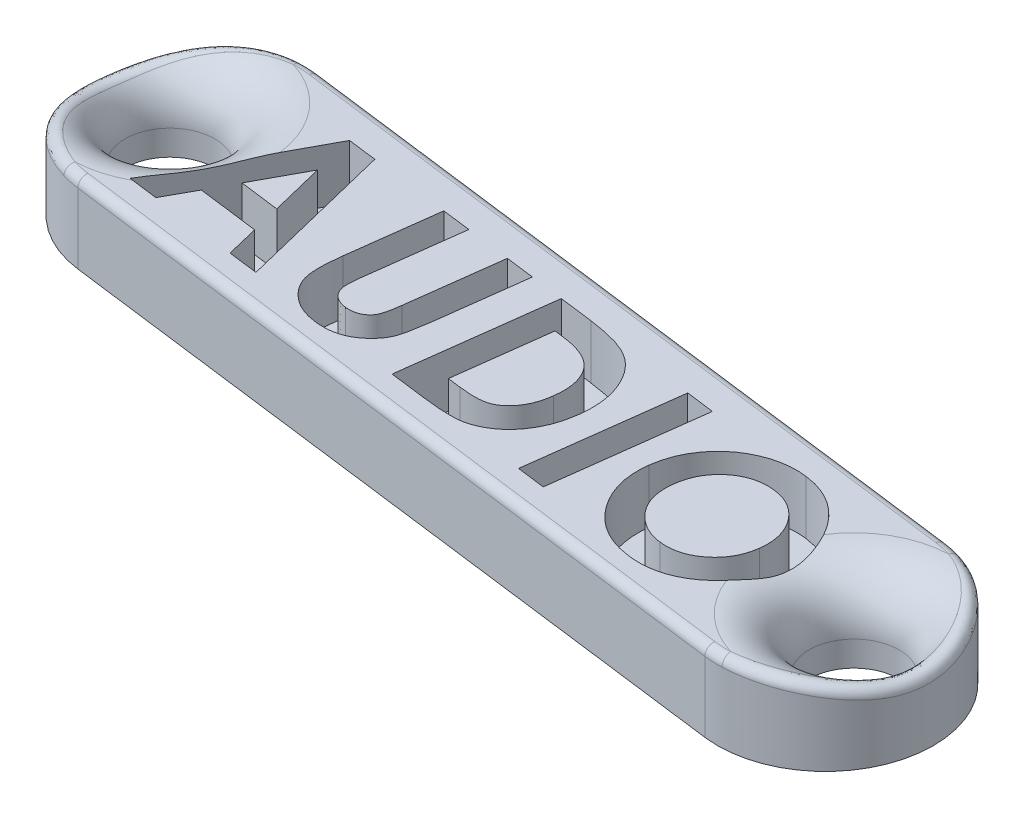
from build123d import *

# Parameters (mm, degrees)
BOSS_EXTRUDE1_DEPTH = 2.2
SKETCH3_R           = 1.25
CUT_EXTRUDE1_DEPTH  = 3
CUT_EXTRUDE2_DEPTH  = 1.5
FILLET1_R           = 1.5
FILLET7_R           = 0.25


with BuildPart() as part:
    # Sketch1 → Boss-Extrude1 (new body)
    with BuildSketch(Plane(origin=(0, 0, 0), x_dir=(1, 0, 0), z_dir=(0, 1, 0))):
        with BuildLine():
            Line((-9.619052023, 4.255904619), (10.380947977, 1.695525004))
            ThreePointArc((10.380947977, 1.695525004), (12.975714811, -1.661137785), (9.619052023, -4.255904619))
            Line((9.619052023, -4.255904619), (-10.380947977, -1.695525004))
            ThreePointArc((-10.380947977, -1.695525004), (-12.975714811, 1.661137785), (-9.619052023, 4.255904619))
        make_face()
    extrude(amount=BOSS_EXTRUDE1_DEPTH)

    # Sketch3 → Cut-Extrude1 (cut)
    with BuildSketch(Plane(origin=(0, 2.2, 0), x_dir=(1, 0, 0), z_dir=(0, 1, 0))):
        with Locations(Location((-10.910954308, 1.39680925, 0), (0, 0, 270))):
            Circle(SKETCH3_R)
        with Locations(Location((10.910954308, -1.39680925, 0), (0, 0, 270))):
            Circle(SKETCH3_R)
    extrude(amount=-CUT_EXTRUDE1_DEPTH, mode=Mode.SUBTRACT)

    # Sketch2 → Cut-Extrude2 (cut)
    # profile 1 of 5: a face of its own
    with BuildSketch(Plane(origin=(0, 2.2, 0), x_dir=(1, 0, 0), z_dir=(0, 1, 0))):
        Polygon((-7.499907306, 2.981760172), (-6.695133001, 2.879149328), (-5.624079315, -1.498348001), (-6.449206185, -1.392345063), (-6.665452178, -0.491744101), (-8.366587328, -0.273802061), (-8.816887809, -1.089600672), (-9.642014678, -0.983597734), align=None)
        Polygon((-7.233627926, 1.824208089), (-7.972256398, 0.462282341), (-6.863889678, 0.320662416), align=None, mode=Mode.SUBTRACT)
    # profile 2 of 5: a face of its own
    with BuildSketch(Plane(origin=(0, 2.2, 0), x_dir=(1, 0, 0), z_dir=(0, 1, 0))):
        with BuildLine():
            Line((-4.492346767, 2.596629268), (-3.695204673, 2.494866447))
            Line((-3.695204673, 2.494866447), (-4.041198263, -0.20524039))
            add(Edge.make_bspline(
                [(-4.041198263, -0.20524039), (-4.044350543, -0.233220092), (-4.050428196, -0.28716546), (-4.058510565, -0.365109825), (-4.062947319, -0.436976614), (-4.063410598, -0.502899724), (-4.062904462, -0.562579528), (-4.059993215, -0.616179761), (-4.053019993, -0.663481555), (-4.040986997, -0.717940974), (-4.018879198, -0.780298887), (-3.979474082, -0.847394566), (-3.932171943, -0.910674282), (-3.871915712, -0.965548078), (-3.802711013, -1.01297883), (-3.724150919, -1.05080237), (-3.636902593, -1.077913456), (-3.575229403, -1.087945078), (-3.543408466, -1.093120999)],
                knots=[0, 0, 0, 0, 1.150530379, 2.218243335, 3.20172775, 4.091186529, 4.911349013, 5.640491897, 6.282451106, 6.862508571, 7.918410735, 8.968548265, 10.031251396, 11.134605503, 12.281535566, 13.449044401, 14.683807366, 16, 16, 16, 16], degree=3))
            add(Edge.make_bspline(
                [(-3.543408466, -1.093120999), (-3.50951621, -1.096299337), (-3.443437117, -1.102496083), (-3.346371442, -1.096269477), (-3.254677658, -1.077967009), (-3.170325373, -1.04510445), (-3.09324207, -1.003719818), (-3.027059304, -0.951794881), (-2.970948657, -0.892827295), (-2.932839635, -0.835671257), (-2.908529546, -0.782208761), (-2.889619828, -0.734030362), (-2.873292382, -0.676446056), (-2.856334934, -0.610910285), (-2.840221539, -0.536510236), (-2.825097352, -0.453343143), (-2.810841722, -0.361420578), (-2.802385443, -0.297128107), (-2.797995806, -0.263754012)],
                knots=[0, 0, 0, 0, 1.264246848, 2.464878296, 3.602902448, 4.727446823, 5.818930376, 6.845081526, 7.841566789, 8.835776144, 9.38129008, 10.023558647, 10.758576168, 11.6050415, 12.541145857, 13.588560298, 14.748226399, 16, 16, 16, 16], degree=3))
            Line((-2.797995806, -0.263754012), (-2.464722569, 2.337134075))
            Line((-2.464722569, 2.337134075), (-1.667580475, 2.235371255))
            Line((-1.667580475, 2.235371255), (-1.986437312, -0.251881683))
            add(Edge.make_bspline(
                [(-1.986437312, -0.251881683), (-1.993054605, -0.302220216), (-2.005783853, -0.39905313), (-2.026749363, -0.537917819), (-2.049201186, -0.664452884), (-2.070366291, -0.778984655), (-2.094381833, -0.880637717), (-2.118168058, -0.969979039), (-2.141131231, -1.047713975), (-2.175273393, -1.1347151), (-2.225558103, -1.234314336), (-2.302115313, -1.345418171), (-2.39348753, -1.452943766), (-2.499119968, -1.553796451), (-2.614695491, -1.645808464), (-2.738404595, -1.723469558), (-2.8679181, -1.786100148), (-3.004144343, -1.832024883), (-3.147512338, -1.862987723), (-3.299075182, -1.87729693), (-3.459596271, -1.879018977), (-3.568637728, -1.866851349), (-3.624818723, -1.860582271)],
                knots=[0, 0, 0, 0, 1.15283147, 2.217625841, 3.188433464, 4.070854866, 4.861764269, 5.559257831, 6.170365235, 6.700775839, 7.679613089, 8.69613027, 9.757126222, 10.878381655, 12.007107569, 13.105890525, 14.188183861, 15.265976203, 16.36248846, 17.510808412, 18.71750375, 20, 20, 20, 20], degree=3))
            add(Edge.make_bspline(
                [(-3.624818723, -1.860582271), (-3.661909307, -1.855010728), (-3.735024734, -1.844027733), (-3.842048143, -1.821513151), (-3.944186068, -1.791477138), (-4.041934896, -1.755849134), (-4.135734535, -1.714444754), (-4.224372852, -1.66587675), (-4.309245564, -1.612378123), (-4.38831571, -1.552389354), (-4.46153699, -1.487874984), (-4.530055548, -1.4216295), (-4.592115734, -1.352585716), (-4.645966787, -1.279571148), (-4.696040464, -1.206385125), (-4.737642493, -1.129085099), (-4.772905651, -1.04956648), (-4.803995577, -0.96643463), (-4.826941415, -0.874897005), (-4.8436543, -0.772236031), (-4.853184724, -0.656569253), (-4.857158129, -0.52836875), (-4.855437888, -0.387166739), (-4.846373053, -0.233053127), (-4.832062674, -0.06591144), (-4.818330576, 0.049485311), (-4.811203605, 0.10937633)],
                knots=[0, 0, 0, 0, 1.021325217, 2.013304236, 2.975565624, 3.918039621, 4.845044506, 5.764765062, 6.668102515, 7.574942875, 8.464230678, 9.324352422, 10.169496251, 10.988574592, 11.793494596, 12.582351764, 13.374918752, 14.161519028, 14.996114242, 15.940221643, 16.991229592, 18.154278434, 19.432254303, 20.83542015, 22.357580195, 24, 24, 24, 24], degree=3))
            Line((-4.811203605, 0.10937633), (-4.492346767, 2.596629268))
        make_face()
    # profile 3 of 5: a face of its own
    with BuildSketch(Plane(origin=(0, 2.2, 0), x_dir=(1, 0, 0), z_dir=(0, 1, 0))):
        with BuildLine():
            Line((-0.746413076, 2.117703395), (0.194893014, 1.996436034))
            add(Edge.make_bspline(
                [(0.194893014, 1.996436034), (0.268207414, 1.986621769), (0.410171681, 1.967617657), (0.614456643, 1.929528599), (0.803827753, 1.889072628), (0.977246792, 1.841371525), (1.135365761, 1.789123158), (1.278137773, 1.731908867), (1.405313112, 1.669190445), (1.518385197, 1.600622546), (1.620030318, 1.52411208), (1.714994541, 1.441340375), (1.803664765, 1.349924326), (1.88612782, 1.250370924), (1.96227881, 1.142415072), (2.03299089, 1.026634777), (2.097384663, 0.902444845), (2.155515183, 0.770785272), (2.206527456, 0.633390455), (2.247221048, 0.490725264), (2.278698848, 0.344294674), (2.299737629, 0.193208995), (2.311455764, 0.038283015), (2.314069694, -0.121149214), (2.306483902, -0.284566909), (2.294088706, -0.394480364), (2.287815023, -0.450111775)],
                knots=[0, 0, 0, 0, 1.441511073, 2.791307885, 4.049291889, 5.214859528, 6.295106222, 7.293692796, 8.210315823, 9.056038773, 9.867075778, 10.687046818, 11.509180812, 12.346552832, 13.20418093, 14.082029974, 14.988914079, 15.928757192, 16.885756699, 17.843136786, 18.817878494, 19.802782428, 20.814011466, 21.844465783, 22.909001535, 24, 24, 24, 24], degree=3))
            add(Edge.make_bspline(
                [(2.287815023, -0.450111775), (2.275604058, -0.528674297), (2.251582925, -0.683220711), (2.192776358, -0.907195875), (2.114375971, -1.118671054), (2.018125937, -1.316694615), (1.90574764, -1.498749151), (1.779582139, -1.662738742), (1.641023209, -1.808410328), (1.48914204, -1.932326087), (1.330050054, -2.036597389), (1.16642745, -2.120719996), (0.999082539, -2.182928563), (0.854627569, -2.218828077), (0.730255832, -2.233943263), (0.622717517, -2.241776252), (0.500451416, -2.242381886), (0.363540207, -2.240406049), (0.212040766, -2.230893978), (0.045698985, -2.218790413), (-0.134848247, -2.19940246), (-0.259947454, -2.184454276), (-0.324945394, -2.17668763)],
                knots=[0, 0, 0, 0, 1.320131722, 2.596933229, 3.839050965, 5.0613405, 6.248505358, 7.386875481, 8.492832378, 9.580504248, 10.635480279, 11.647735496, 12.629884191, 13.595720994, 14.111771925, 14.709638867, 15.385904643, 16.142065674, 16.983931199, 17.907006673, 18.912541023, 20, 20, 20, 20], degree=3))
            Line((-0.324945394, -2.17668763), (-1.280667883, -2.053724222))
            Line((-1.280667883, -2.053724222), (-0.746413076, 2.117703395))
        make_face()
        with BuildLine():
            Line((-0.053577873, 1.250175351), (-0.390243204, -1.378697513))
            Line((-0.390243204, -1.378697513), (-0.021352979, -1.426186829))
            add(Edge.make_bspline(
                [(-0.021352979, -1.426186829), (0.022438602, -1.431183576), (0.107091524, -1.440842722), (0.230056989, -1.451725497), (0.344384953, -1.45534835), (0.449685474, -1.456419658), (0.545879107, -1.449873952), (0.633622411, -1.44067972), (0.712361861, -1.424361879), (0.805976099, -1.39754825), (0.914071994, -1.34769302), (1.032422607, -1.264626693), (1.143507793, -1.160569029), (1.225278924, -1.056087819), (1.286976863, -0.963395267), (1.327815638, -0.886412626), (1.366936394, -0.805792239), (1.399242721, -0.719197204), (1.428207728, -0.62837034), (1.452896345, -0.532695904), (1.473189175, -0.432183909), (1.483094774, -0.363103476), (1.488128858, -0.327996391)],
                knots=[0, 0, 0, 0, 1.222943704, 2.36405612, 3.423577425, 4.396100567, 5.284050325, 6.097335924, 6.841794702, 7.511894812, 8.796436268, 10.121334184, 11.508490857, 13.004045001, 13.791507837, 14.595207135, 15.419647787, 16.276108515, 17.156649721, 18.064026054, 19.016126571, 20, 20, 20, 20], degree=3))
            add(Edge.make_bspline(
                [(1.488128858, -0.327996391), (1.494212657, -0.274071177), (1.506068357, -0.168985311), (1.50681857, -0.014060514), (1.497804091, 0.133059518), (1.47371044, 0.272229146), (1.437416446, 0.403661127), (1.387807042, 0.527259741), (1.326454821, 0.643757653), (1.274771875, 0.713965416), (1.24898623, 0.74899346)],
                knots=[0, 0, 0, 0, 1.148125142, 2.237389831, 3.275214987, 4.264994133, 5.221876859, 6.156492002, 7.080237364, 8, 8, 8, 8], degree=3))
            add(Edge.make_bspline(
                [(1.24898623, 0.74899346), (1.222944415, 0.779475021), (1.170151534, 0.841268313), (1.07402826, 0.920730581), (0.96553773, 0.992557192), (0.842443299, 1.055073488), (0.705614749, 1.109263224), (0.554737866, 1.153584677), (0.390443654, 1.190414767), (0.275595349, 1.20687731), (0.216093602, 1.215406387)],
                knots=[0, 0, 0, 0, 0.827122686, 1.676772149, 2.566211406, 3.511931951, 4.523968942, 5.603243107, 6.758264465, 8, 8, 8, 8], degree=3))
            Line((0.216093602, 1.215406387), (-0.053577873, 1.250175351))
        make_face(mode=Mode.SUBTRACT)
    # profile 4 of 5: a face of its own
    with BuildSketch(Plane(origin=(0, 2.2, 0), x_dir=(1, 0, 0), z_dir=(0, 1, 0))):
        Polygon((3.285621199, 1.601559271), (4.073435035, 1.500644474), (3.539180227, -2.670783143), (2.751366392, -2.569868346), align=None)
    # profile 5 of 5: a face of its own
    with BuildSketch(Plane(origin=(0, 2.2, 0), x_dir=(1, 0, 0), z_dir=(0, 1, 0))):
        with BuildLine():
            add(Edge.make_bspline(
                [(6.941838479, 1.23876913), (7.014220439, 1.227834397), (7.156840416, 1.206288817), (7.363359413, 1.148322001), (7.559464699, 1.071539899), (7.745722012, 0.976793272), (7.921081713, 0.861778994), (8.085881343, 0.728013354), (8.241057005, 0.575585004), (8.382701426, 0.405107533), (8.510120237, 0.223159107), (8.617431745, 0.03213815), (8.704917921, -0.164658679), (8.770331253, -0.368242692), (8.814692257, -0.577967011), (8.837333589, -0.793883117), (8.839503314, -1.016053903), (8.824454793, -1.165178552), (8.816818447, -1.240851596)],
                knots=[0, 0, 0, 0, 1.015592029, 2.001102393, 2.970435924, 3.935828492, 4.897031606, 5.876521711, 6.878401275, 7.912063187, 8.949629442, 9.958304552, 10.949363531, 11.934850449, 12.921665044, 13.920256757, 14.944637902, 16, 16, 16, 16], degree=3))
            add(Edge.make_bspline(
                [(8.816818447, -1.240851596), (8.805629785, -1.315220271), (8.783577308, -1.461798419), (8.724465614, -1.673620536), (8.649075866, -1.874722046), (8.55583586, -2.065157014), (8.442004529, -2.243266188), (8.309794238, -2.40994533), (8.159977764, -2.566036458), (7.992902873, -2.707753859), (7.814475232, -2.834689342), (7.627379802, -2.941578418), (7.435070885, -3.029414436), (7.236001268, -3.093740813), (7.031460266, -3.138149452), (6.820982574, -3.161757794), (6.604382232, -3.165028868), (6.459225721, -3.149834114), (6.385535061, -3.142120293)],
                knots=[0, 0, 0, 0, 1.049436533, 2.068403997, 3.064103519, 4.045710904, 5.023667923, 6.010121452, 7.012435228, 8.040083337, 9.065294593, 10.066137987, 11.044971061, 12.012474343, 12.981900572, 13.963222145, 14.966002258, 16, 16, 16, 16], degree=3))
            add(Edge.make_bspline(
                [(6.385535061, -3.142120293), (6.309202098, -3.130617003), (6.158979218, -3.107978588), (5.9421616, -3.048810888), (5.738000418, -2.970389458), (5.546221241, -2.873186158), (5.366143149, -2.757880592), (5.200146002, -2.621461775), (5.045671123, -2.467387672), (4.906472068, -2.295389587), (4.783758563, -2.111611997), (4.678274809, -1.921498102), (4.595189171, -1.725097864), (4.530671971, -1.524369255), (4.488203683, -1.317621196), (4.466860237, -1.106044974), (4.462895682, -0.889268738), (4.47820501, -0.744390943), (4.485962411, -0.670979802)],
                knots=[0, 0, 0, 0, 1.066296362, 2.098465794, 3.099085616, 4.084609346, 5.065443776, 6.048524718, 7.048663833, 8.076282552, 9.10143221, 10.099913789, 11.076747741, 12.044293368, 13.009809346, 13.987994215, 14.980494972, 16, 16, 16, 16], degree=3))
            add(Edge.make_bspline(
                [(4.485962411, -0.670979802), (4.493242699, -0.621681959), (4.507678564, -0.523930746), (4.540318854, -0.38035603), (4.581228027, -0.240793529), (4.62984485, -0.104981127), (4.689127058, 0.025663023), (4.75525693, 0.152919841), (4.83064323, 0.275622002), (4.91487165, 0.393468786), (5.005833534, 0.505849946), (5.103608086, 0.610899587), (5.206392935, 0.709320563), (5.316350694, 0.798991049), (5.431594068, 0.88243993), (5.553050339, 0.957766922), (5.680212608, 1.026035794), (5.812482903, 1.086648309), (5.948681107, 1.139129328), (6.086810003, 1.182619808), (6.226587437, 1.215685364), (6.36737965, 1.239440512), (6.509313292, 1.253947635), (6.652348208, 1.258831926), (6.796924139, 1.25528057), (6.893274772, 1.244302445), (6.941838479, 1.23876913)],
                knots=[0, 0, 0, 0, 1.036796182, 2.055832069, 3.061105233, 4.06230775, 5.055057488, 6.044454865, 7.04534623, 8.049275837, 9.057179238, 10.052088038, 11.034129852, 12.016365475, 13.002521933, 13.993404828, 14.988313628, 16.004424569, 17.01937681, 18.024133433, 19.015836776, 20.006195625, 20.993719821, 21.982679858, 22.983208088, 24, 24, 24, 24], degree=3))
        make_face()
        with BuildLine():
            add(Edge.make_bspline(
                [(6.834139494, 0.463675647), (6.786702592, 0.468618952), (6.693396129, 0.478342232), (6.554192383, 0.475793666), (6.419168828, 0.462088585), (6.288183938, 0.43358869), (6.161499301, 0.392273103), (6.039487699, 0.336119377), (5.921014491, 0.268261353), (5.808159462, 0.187031359), (5.702938885, 0.095491975), (5.607705075, -0.005376174), (5.524626574, -0.11495853), (5.45269664, -0.233136621), (5.392525836, -0.35961923), (5.344187146, -0.494917813), (5.306346334, -0.638159667), (5.291499022, -0.737509944), (5.283952529, -0.788007045)],
                knots=[0, 0, 0, 0, 1.026868921, 2.019809517, 2.993830555, 3.947215497, 4.902621972, 5.859425468, 6.836318243, 7.840387746, 8.850609445, 9.837402903, 10.824196361, 11.808260095, 12.813622098, 13.836744533, 14.90047484, 16, 16, 16, 16], degree=3))
            add(Edge.make_bspline(
                [(5.283952529, -0.788007045), (5.278302048, -0.844478713), (5.26727188, -0.954715701), (5.270009763, -1.117928186), (5.289158063, -1.274155692), (5.32606619, -1.423422818), (5.378463847, -1.566099465), (5.449070914, -1.701029323), (5.535443036, -1.829251699), (5.604951245, -1.906481066), (5.6401224, -1.945559129)],
                knots=[0, 0, 0, 0, 1.084790053, 2.117592638, 3.114798386, 4.089110894, 5.052243199, 6.014692363, 6.995434269, 8, 8, 8, 8], degree=3))
            add(Edge.make_bspline(
                [(5.6401224, -1.945559129), (5.669332183, -1.974898737), (5.727028532, -2.032851524), (5.821042412, -2.110223609), (5.919280394, -2.178416309), (6.022968652, -2.236131443), (6.130627432, -2.286046392), (6.244310832, -2.324378038), (6.361988817, -2.355933195), (6.443042861, -2.367818893), (6.483905787, -2.373810998)],
                knots=[0, 0, 0, 0, 1.028375553, 2.031289188, 3.021201381, 3.996270266, 4.977092117, 5.965732201, 6.974435699, 8, 8, 8, 8], degree=3))
            add(Edge.make_bspline(
                [(6.483905787, -2.373810998), (6.530209043, -2.378817517), (6.621811677, -2.388722011), (6.758272507, -2.385152739), (6.891235825, -2.370221317), (7.020432834, -2.341491335), (7.145896726, -2.298093231), (7.2686156, -2.243763678), (7.385960679, -2.172496995), (7.499789085, -2.091378046), (7.605822986, -1.998849973), (7.701035508, -1.897573959), (7.7853055, -1.789253042), (7.856118569, -1.672397294), (7.917310418, -1.548736546), (7.965068976, -1.416928678), (8.002392483, -1.277931479), (8.016660675, -1.181957966), (8.023916471, -1.133152611)],
                knots=[0, 0, 0, 0, 1.013354213, 2.004738435, 2.965424096, 3.924352411, 4.880291768, 5.852975684, 6.841258172, 7.864698723, 8.894452879, 9.900543349, 10.88815443, 11.877529378, 12.87151005, 13.888262347, 14.926119299, 16, 16, 16, 16], degree=3))
            add(Edge.make_bspline(
                [(8.023916471, -1.133152611), (8.029114044, -1.084308743), (8.039340195, -0.988209135), (8.038016563, -0.84471984), (8.023791338, -0.705581061), (7.996251504, -0.570475725), (7.95682478, -0.439075554), (7.90171781, -0.312499383), (7.834505241, -0.189813467), (7.754985732, -0.072823383), (7.666350068, 0.036887915), (7.568126979, 0.134693443), (7.463706433, 0.221013804), (7.351595694, 0.294529988), (7.232383504, 0.355652827), (7.106349733, 0.405088675), (6.973016526, 0.44208449), (6.880963942, 0.456395869), (6.834139494, 0.463675647)],
                knots=[0, 0, 0, 0, 1.062508236, 2.090469654, 3.099314799, 4.085699367, 5.070887614, 6.06311896, 7.068097217, 8.0948196, 9.121159038, 10.116272675, 11.090089861, 12.048932845, 13.012197312, 13.984821966, 14.97493808, 16, 16, 16, 16], degree=3))
        make_face(mode=Mode.SUBTRACT)
    extrude(amount=-CUT_EXTRUDE2_DEPTH, mode=Mode.SUBTRACT)

    # Fillet1
    # the kernel refuses this fillet: 1.5 mm, written as the material it takes off along each edge
    with BuildSketch(Plane(origin=(10.910954308, 2.2, 1.39680925), x_dir=(0, 0, 1), z_dir=(-1, 0, 0))) as fillet1_piece_1:
        with BuildLine():
            CenterArc((1.25 + FILLET1_R, -FILLET1_R), FILLET1_R, 90, 90)
            Line((1.25, -FILLET1_R), (1.25, 0))
            Line((1.25, 0), (1.25 + FILLET1_R, 0))
        make_face()
    revolve(axis=Axis((10.910954308, 2.2, 1.39680925), (0, 1, 0)), mode=Mode.SUBTRACT)
    with BuildSketch(Plane(origin=(-10.910954308, 2.2, -1.39680925), x_dir=(0, 0, 1), z_dir=(-1, 0, 0))) as fillet1_piece_2:
        with BuildLine():
            CenterArc((1.25 + FILLET1_R, -FILLET1_R), FILLET1_R, 90, 90)
            Line((1.25, -FILLET1_R), (1.25, 0))
            Line((1.25, 0), (1.25 + FILLET1_R, 0))
        make_face()
    revolve(axis=Axis((-10.910954308, 2.2, -1.39680925), (0, 1, 0)), mode=Mode.SUBTRACT)

    # Fillet7
    fillet7_edges = [part.edges().sort_by_distance(p)[0] for p in [
        (10.2578665, 2.2, 4.269086739),
        (-11.002481905, 2.2, 1.547358606),
        (11.002481905, 2.2, -1.547358606),
        (12.977412337, 2.042860645, 1.647634723),
        (-12.975714811, 2.04285387, -1.661137785),
        (0.380947977, 2.2, -2.975714811),
        (-10.2578665, 2.2, -4.269086739),
        (-0.380947977, 2.2, 2.975714811),
    ]]
    fillet(fillet7_edges, radius=FILLET7_R)


solid = part.part
